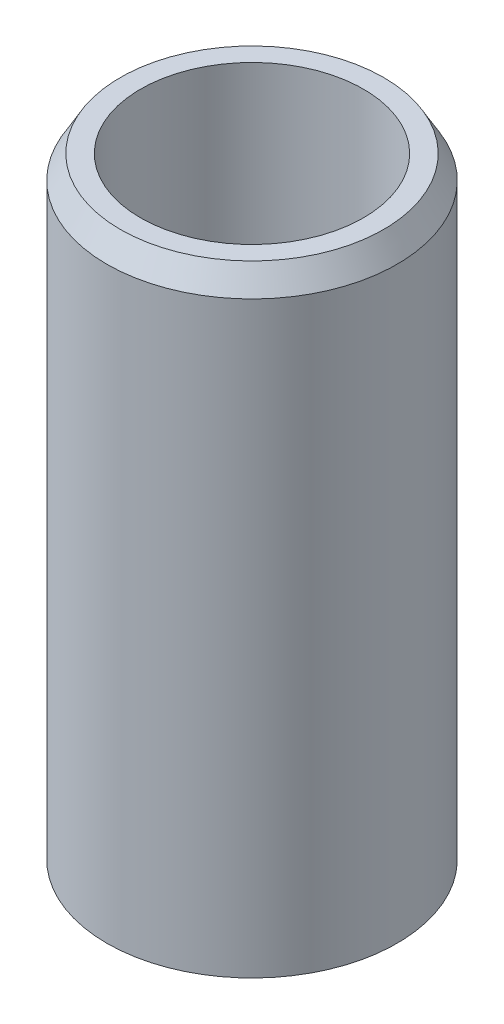
from build123d import *
from OCP.BRepFilletAPI import BRepFilletAPI_MakeChamfer

# Parameters (mm, degrees)
SKETCH1_R           = 32.5
BOSS_EXTRUDE1_DEPTH = 139.920728446
SKETCH2_R           = 24.966365606
CUT_EXTRUDE1_DEPTH  = 148.276305796
CHAMFER1_SIZE       = 5.230980569
CHAMFER1_SIZE2      = 3.020108039


with BuildPart() as part:
    # Sketch1 → Boss-Extrude1 (new body)
    with BuildSketch(Plane(origin=(0, 0, 0), x_dir=(1, 0, 0), z_dir=(0, 1, 0))):
        Circle(SKETCH1_R)
    extrude(amount=BOSS_EXTRUDE1_DEPTH)

    # Sketch2 → Cut-Extrude1 (cut, through all)
    with BuildSketch(Plane(origin=(0, 0, 0), x_dir=(1, 0, 0), z_dir=(0, 1, 0))):
        Circle(SKETCH2_R)
    extrude(amount=CUT_EXTRUDE1_DEPTH, mode=Mode.SUBTRACT)

    # Chamfer1: one chamfer whose edges measure the first distance from different faces: ONE call of the kernel's chamfer builder (chamfer() names one face for all edges)
    chamfer1_edges_1 = [part.edges().sort_by_distance(p)[0] for p in [
        (-32.5, 139.920728446, 0),
    ]]
    chamfer1_side_1 = [part.faces().sort_by_distance(p)[0] for p in [
        (-32.5, 69.960364223, 0),
    ]]
    chamfer1_edges_2 = [part.edges().sort_by_distance(p)[0] for p in [
        (-32.5, 0, 0),
    ]]
    chamfer1_side_2 = [part.faces().sort_by_distance(p)[0] for p in [
        (-31.580761184, 0, 0),
    ]]
    chamfer1 = BRepFilletAPI_MakeChamfer(part.part.solid().wrapped)
    for e in chamfer1_edges_1:
        chamfer1.Add(CHAMFER1_SIZE, CHAMFER1_SIZE2, e.wrapped, chamfer1_side_1[0].wrapped)  # the first distance lies on this face
    for e in chamfer1_edges_2:
        chamfer1.Add(CHAMFER1_SIZE, CHAMFER1_SIZE2, e.wrapped, chamfer1_side_2[0].wrapped)  # the first distance lies on this face
    add(Compound.cast(chamfer1.Shape()), mode=Mode.REPLACE)


solid = part.part
